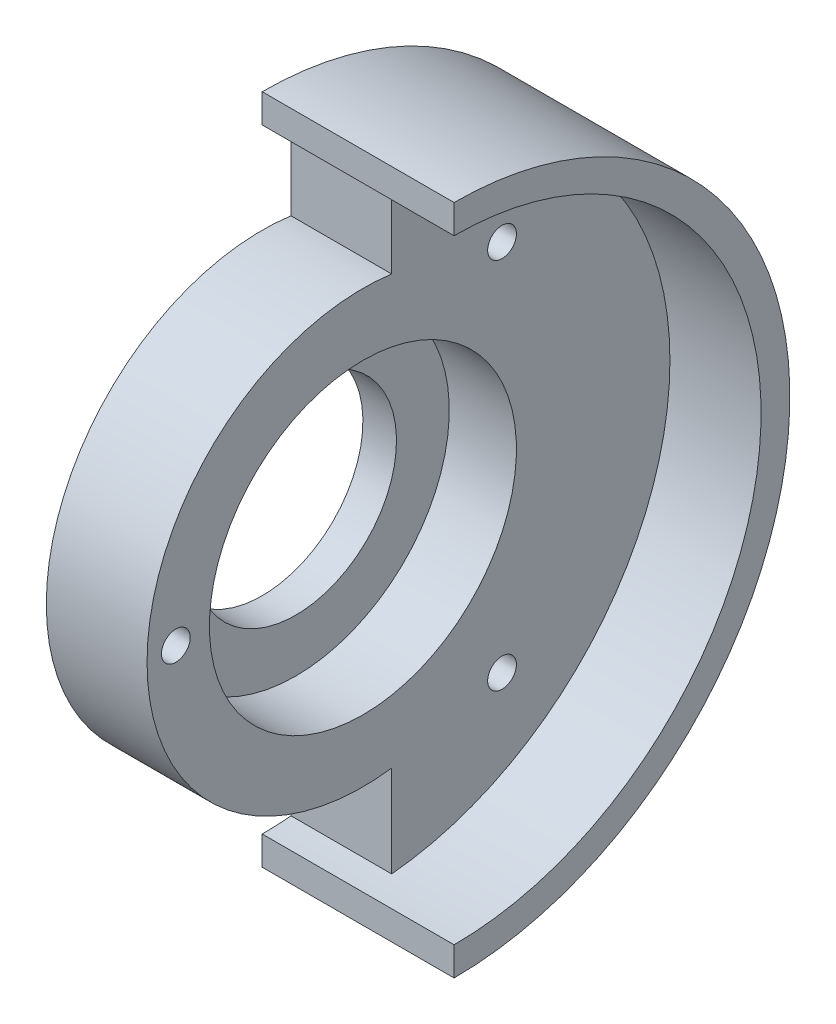
from build123d import *
from build123d.topology import SkipClean

# Parameters (mm, degrees)
CUT_EXTRUDE1_DEPTH      = 51.598913032
CUT_EXTRUDE1_DEPTH_BACK = 51.598913032
SKETCH2_R               = 1.5
SKETCH3_R               = 2.75
CUT_EXTRUDE2_DEPTH      = 5


with BuildPart() as part:
    # Sketch1 → Revolve1 (revolve)
    with BuildSketch(Plane.XY):
        Polygon((20, 35), (20, 32), (10.5, 32), (10.5, 16), (3.5, 16), (3.5, 10.5), (0, 10.5), (0, 35), align=None)
    revolve(axis=Axis((20, 0, 0), (-1, 0, 0)))

    # Sketch2 → Cut-Extrude1 (cut, two sides: drawn at the far end of the back side and taken through both)
    with SkipClean():  # the faces are left unmerged after this step: merging them gives an invalid solid
        with BuildSketch(Plane(origin=(10.5, 0, 0), x_dir=(0, 0, -1), z_dir=(1, 0, 0)).offset(-CUT_EXTRUDE1_DEPTH_BACK)):
            with Locations((-19.5, 0)):
                Circle(SKETCH2_R)
            with Locations((14.5, -19.437399517)):
                Circle(SKETCH2_R)
            with Locations((14.5, 19.437399517)):
                Circle(SKETCH2_R)
            with BuildLine():
                Line((3, 22.299103121), (3, 31.859064644))
                ThreePointArc((3, 31.859064644), (1.501654319, 31.964746742), (0, 32))
                Line((0, 32), (0, 35))
                ThreePointArc((0, 35), (-35, 0), (0, -35))
                Line((0, -35), (0, -32))
                ThreePointArc((0, -32), (1.501654319, -31.964746742), (3, -31.859064644))
                Line((3, -31.859064644), (3, -22.299103121))
                ThreePointArc((3, -22.299103121), (-22.5, 0), (3, 22.299103121))
            make_face()
        extrude(amount=CUT_EXTRUDE1_DEPTH + CUT_EXTRUDE1_DEPTH_BACK, mode=Mode.SUBTRACT)

    # Sketch3 → Cut-Extrude2 (cut)
    with SkipClean():  # the faces are left unmerged after this step: merging them gives an invalid solid
        with BuildSketch(Plane.ZY):
            with Locations((-14.5, 19.437399517)):
                Circle(SKETCH3_R)
            with Locations((19.5, 0)):
                Circle(SKETCH3_R)
            with Locations((-14.5, -19.437399517)):
                Circle(SKETCH3_R)
        extrude(amount=-CUT_EXTRUDE2_DEPTH, mode=Mode.SUBTRACT)


solid = part.part
